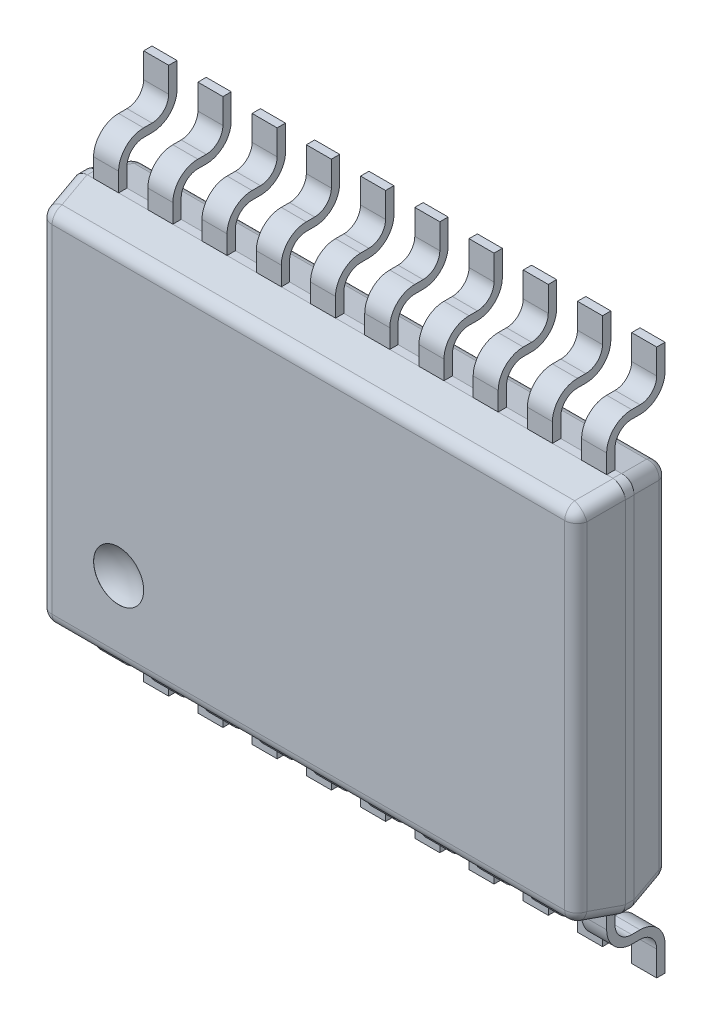
from build123d import *
from OCP.BRepFilletAPI import BRepFilletAPI_MakeChamfer

# Parameters (mm, degrees)
SKETCH1_W         = 6.6
SKETCH1_H         = 4.5
EXTRUDE2_DEPTH    = 1.1
CHAMFER2_SIZE     = 0.5
CHAMFER2_SIZE2    = 0.106278281
CHAMFER3_SIZE     = 0.5
CHAMFER3_SIZE2    = 0.106278281
FILLET1_R         = 0.15
SKETCH2_W         = 0.3
SKETCH2_H         = 1.025
EXTRUDE3_DEPTH    = 0.7
EXTRUDE3_2_DEPTH  = 0.7
EXTRUDE3_3_DEPTH  = 0.7
EXTRUDE3_4_DEPTH  = 0.7
EXTRUDE3_5_DEPTH  = 0.7
EXTRUDE3_6_DEPTH  = 0.7
EXTRUDE3_7_DEPTH  = 0.7
EXTRUDE3_8_DEPTH  = 0.7
EXTRUDE3_9_DEPTH  = 0.7
EXTRUDE3_10_DEPTH = 0.7
EXTRUDE4_DEPTH    = 8.266790989
SKETCH4_R         = 0.3
EXTRUDE5_DEPTH    = 0.001
DOME1_FACE_RADIUS = 0.3
DOME1_HEIGHT      = 0.1


with BuildPart() as part:
    # Sketch1 → Extrude2 (new body)
    with BuildSketch(Plane.XY.offset(0.1)):
        Rectangle(SKETCH1_W, SKETCH1_H)
    extrude(amount=EXTRUDE2_DEPTH)

    # Chamfer2: one chamfer whose edges measure the first distance from different faces: ONE call of the kernel's chamfer builder (chamfer() names one face for all edges)
    chamfer2_edges_1 = [part.edges().sort_by_distance(p)[0] for p in [
        (3.3, 0, 1.2),
    ]]
    chamfer2_side_1 = [part.faces().sort_by_distance(p)[0] for p in [
        (3.3, 0, 0.65),
    ]]
    chamfer2_edges_2 = [part.edges().sort_by_distance(p)[0] for p in [
        (0, 2.25, 1.2),
    ]]
    chamfer2_side_2 = [part.faces().sort_by_distance(p)[0] for p in [
        (0, 2.25, 0.65),
    ]]
    chamfer2_edges_3 = [part.edges().sort_by_distance(p)[0] for p in [
        (-3.3, 0, 1.2),
    ]]
    chamfer2_side_3 = [part.faces().sort_by_distance(p)[0] for p in [
        (-3.3, 0, 0.65),
    ]]
    chamfer2_edges_4 = [part.edges().sort_by_distance(p)[0] for p in [
        (0, -2.25, 1.2),
    ]]
    chamfer2_side_4 = [part.faces().sort_by_distance(p)[0] for p in [
        (0, -2.25, 0.65),
    ]]
    chamfer2 = BRepFilletAPI_MakeChamfer(part.part.solid().wrapped)
    for e in chamfer2_edges_1:
        chamfer2.Add(CHAMFER2_SIZE, CHAMFER2_SIZE2, e.wrapped, chamfer2_side_1[0].wrapped)  # the first distance lies on this face
    for e in chamfer2_edges_2:
        chamfer2.Add(CHAMFER2_SIZE, CHAMFER2_SIZE2, e.wrapped, chamfer2_side_2[0].wrapped)  # the first distance lies on this face
    for e in chamfer2_edges_3:
        chamfer2.Add(CHAMFER2_SIZE, CHAMFER2_SIZE2, e.wrapped, chamfer2_side_3[0].wrapped)  # the first distance lies on this face
    for e in chamfer2_edges_4:
        chamfer2.Add(CHAMFER2_SIZE, CHAMFER2_SIZE2, e.wrapped, chamfer2_side_4[0].wrapped)  # the first distance lies on this face
    add(Compound.cast(chamfer2.Shape()), mode=Mode.REPLACE)

    # Chamfer3: one chamfer whose edges measure the first distance from different faces: ONE call of the kernel's chamfer builder (chamfer() names one face for all edges)
    chamfer3_edges_1 = [part.edges().sort_by_distance(p)[0] for p in [
        (0, 2.25, 0.1),
    ]]
    chamfer3_side_1 = [part.faces().sort_by_distance(p)[0] for p in [
        (0, 2.25, 0.4),
    ]]
    chamfer3_edges_2 = [part.edges().sort_by_distance(p)[0] for p in [
        (3.3, 0, 0.1),
    ]]
    chamfer3_side_2 = [part.faces().sort_by_distance(p)[0] for p in [
        (3.3, 0, 0.4),
    ]]
    chamfer3_edges_3 = [part.edges().sort_by_distance(p)[0] for p in [
        (0, -2.25, 0.1),
    ]]
    chamfer3_side_3 = [part.faces().sort_by_distance(p)[0] for p in [
        (0, -2.25, 0.4),
    ]]
    chamfer3_edges_4 = [part.edges().sort_by_distance(p)[0] for p in [
        (-3.3, 0, 0.1),
    ]]
    chamfer3_side_4 = [part.faces().sort_by_distance(p)[0] for p in [
        (-3.3, 0, 0.4),
    ]]
    chamfer3 = BRepFilletAPI_MakeChamfer(part.part.solid().wrapped)
    for e in chamfer3_edges_1:
        chamfer3.Add(CHAMFER3_SIZE, CHAMFER3_SIZE2, e.wrapped, chamfer3_side_1[0].wrapped)  # the first distance lies on this face
    for e in chamfer3_edges_2:
        chamfer3.Add(CHAMFER3_SIZE, CHAMFER3_SIZE2, e.wrapped, chamfer3_side_2[0].wrapped)  # the first distance lies on this face
    for e in chamfer3_edges_3:
        chamfer3.Add(CHAMFER3_SIZE, CHAMFER3_SIZE2, e.wrapped, chamfer3_side_3[0].wrapped)  # the first distance lies on this face
    for e in chamfer3_edges_4:
        chamfer3.Add(CHAMFER3_SIZE, CHAMFER3_SIZE2, e.wrapped, chamfer3_side_4[0].wrapped)  # the first distance lies on this face
    add(Compound.cast(chamfer3.Shape()), mode=Mode.REPLACE)

    # Fillet1
    fillet1_edges = [part.edges().sort_by_distance(p)[0] for p in [
        (0, 2.143721719, 1.2),
        (-3.193721719, 0, 1.2),
        (0, -2.143721719, 1.2),
        (3.193721719, 0, 1.2),
        (3.3, 2.25, 0.65),
        (3.3, -2.25, 0.65),
        (-3.3, -2.25, 0.65),
        (-3.3, 2.25, 0.65),
        (-3.24686086, -2.19686086, 0.95),
        (-3.24686086, 2.19686086, 0.95),
        (3.24686086, -2.19686086, 0.95),
        (3.24686086, 2.19686086, 0.95),
        (0, 2.143721719, 0.1),
        (3.193721719, 0, 0.1),
        (0, -2.143721719, 0.1),
        (-3.193721719, 0, 0.1),
        (3.24686086, 2.19686086, 0.35),
        (3.24686086, -2.19686086, 0.35),
        (-3.24686086, 2.19686086, 0.35),
        (-3.24686086, -2.19686086, 0.35),
    ]]
    fillet(fillet1_edges, radius=FILLET1_R)


with BuildPart() as body_2:
    # Sketch2 → Extrude3 (new body)
    with BuildSketch(Plane.XY):
        with Locations((2.275, -2.7625)):
            Rectangle(SKETCH2_W, SKETCH2_H)
    extrude3 = extrude(amount=EXTRUDE3_DEPTH)


with BuildPart() as body_3:
    # Sketch2 → Extrude3 2 (new body)
    with BuildSketch(Plane.XY):
        with Locations((2.925, -2.7625)):
            Rectangle(SKETCH2_W, SKETCH2_H)
    extrude3_2 = extrude(amount=EXTRUDE3_2_DEPTH)


with BuildPart() as body_4:
    # Sketch2 → Extrude3 3 (new body)
    with BuildSketch(Plane.XY):
        with Locations((1.625, -2.7625)):
            Rectangle(SKETCH2_W, SKETCH2_H)
    extrude3_3 = extrude(amount=EXTRUDE3_3_DEPTH)


with BuildPart() as body_5:
    # Sketch2 → Extrude3 4 (new body)
    with BuildSketch(Plane.XY):
        with Locations((0.975, -2.7625)):
            Rectangle(SKETCH2_W, SKETCH2_H)
    extrude3_4 = extrude(amount=EXTRUDE3_4_DEPTH)


with BuildPart() as body_6:
    # Sketch2 → Extrude3 5 (new body)
    with BuildSketch(Plane.XY):
        with Locations((0.325, -2.7625)):
            Rectangle(SKETCH2_W, SKETCH2_H)
    extrude3_5 = extrude(amount=EXTRUDE3_5_DEPTH)


with BuildPart() as body_7:
    # Sketch2 → Extrude3 6 (new body)
    with BuildSketch(Plane.XY):
        with Locations((-0.325, -2.7625)):
            Rectangle(SKETCH2_W, SKETCH2_H)
    extrude3_6 = extrude(amount=EXTRUDE3_6_DEPTH)


with BuildPart() as body_8:
    # Sketch2 → Extrude3 7 (new body)
    with BuildSketch(Plane.XY):
        with Locations((-0.975, -2.7625)):
            Rectangle(SKETCH2_W, SKETCH2_H)
    extrude3_7 = extrude(amount=EXTRUDE3_7_DEPTH)


with BuildPart() as body_9:
    # Sketch2 → Extrude3 8 (new body)
    with BuildSketch(Plane.XY):
        with Locations((-1.625, -2.7625)):
            Rectangle(SKETCH2_W, SKETCH2_H)
    extrude3_8 = extrude(amount=EXTRUDE3_8_DEPTH)


with BuildPart() as body_10:
    # Sketch2 → Extrude3 9 (new body)
    with BuildSketch(Plane.XY):
        with Locations((-2.275, -2.7625)):
            Rectangle(SKETCH2_W, SKETCH2_H)
    extrude3_9 = extrude(amount=EXTRUDE3_9_DEPTH)


with BuildPart() as body_11:
    # Sketch2 → Extrude3 10 (new body)
    with BuildSketch(Plane.XY):
        with Locations((-2.925, -2.7625)):
            Rectangle(SKETCH2_W, SKETCH2_H)
    extrude3_10 = extrude(amount=EXTRUDE3_10_DEPTH)


with BuildPart() as extrude4_tool:
    # Sketch3 → Extrude4 (new, through all)
    with BuildSketch(Plane(origin=(3.075, 0, 0), x_dir=(0, 0, -1), z_dir=(1, 0, 0))):
        with BuildLine():
            Line((-0.1, -2.975), (-0.1, -3.275))
            Line((-0.1, -3.275), (-0.7, -3.275))
            Line((-0.7, -3.275), (-0.7, -2.475))
            ThreePointArc((-0.7, -2.475), (-0.612132034, -2.687132034), (-0.4, -2.775))
            Line((-0.4, -2.775), (-0.3, -2.775))
            ThreePointArc((-0.3, -2.775), (-0.158578644, -2.833578644), (-0.1, -2.975))
        make_face()
        with BuildLine():
            Line((-0.6, -2.25), (0, -2.25))
            Line((0, -2.25), (0, -2.975))
            ThreePointArc((0, -2.975), (-0.087867966, -2.762867966), (-0.3, -2.675))
            Line((-0.3, -2.675), (-0.4, -2.675))
            ThreePointArc((-0.4, -2.675), (-0.541421356, -2.616421356), (-0.6, -2.475))
            Line((-0.6, -2.475), (-0.6, -2.25))
        make_face()
    extrude4 = extrude(amount=-EXTRUDE4_DEPTH)


with BuildPart() as body_2_1:
    add(body_2.part)

    # Extrude4: cut by extrude4_tool
    add(extrude4_tool.part, mode=Mode.SUBTRACT)


with BuildPart() as body_3_1:
    add(body_3.part)

    # Extrude4: cut by extrude4_tool
    add(extrude4_tool.part, mode=Mode.SUBTRACT)


with BuildPart() as body_4_1:
    add(body_4.part)

    # Extrude4: cut by extrude4_tool
    add(extrude4_tool.part, mode=Mode.SUBTRACT)


with BuildPart() as body_5_1:
    add(body_5.part)

    # Extrude4: cut by extrude4_tool
    add(extrude4_tool.part, mode=Mode.SUBTRACT)


with BuildPart() as body_6_1:
    add(body_6.part)

    # Extrude4: cut by extrude4_tool
    add(extrude4_tool.part, mode=Mode.SUBTRACT)


with BuildPart() as body_7_1:
    add(body_7.part)

    # Extrude4: cut by extrude4_tool
    add(extrude4_tool.part, mode=Mode.SUBTRACT)


with BuildPart() as body_8_1:
    add(body_8.part)

    # Extrude4: cut by extrude4_tool
    add(extrude4_tool.part, mode=Mode.SUBTRACT)


with BuildPart() as body_9_1:
    add(body_9.part)

    # Extrude4: cut by extrude4_tool
    add(extrude4_tool.part, mode=Mode.SUBTRACT)


with BuildPart() as body_10_1:
    add(body_10.part)

    # Extrude4: cut by extrude4_tool
    add(extrude4_tool.part, mode=Mode.SUBTRACT)


with BuildPart() as body_11_1:
    add(body_11.part)

    # Extrude4: cut by extrude4_tool
    add(extrude4_tool.part, mode=Mode.SUBTRACT)


with BuildPart() as part_1:
    add(part.part)

    # Mirror1: Extrude3, Extrude3 2, Extrude3 3, Extrude3 4, Extrude3 5, Extrude3 6, Extrude3 7, Extrude3 8, Extrude3 9, Extrude3 10, Extrude4 across plane
    add(extrude3.mirror(Plane.ZX))
    add(extrude3_2.mirror(Plane.ZX))
    add(extrude3_3.mirror(Plane.ZX))
    add(extrude3_4.mirror(Plane.ZX))
    add(extrude3_5.mirror(Plane.ZX))
    add(extrude3_6.mirror(Plane.ZX))
    add(extrude3_7.mirror(Plane.ZX))
    add(extrude3_8.mirror(Plane.ZX))
    add(extrude3_9.mirror(Plane.ZX))
    add(extrude3_10.mirror(Plane.ZX))
    add(extrude4.mirror(Plane.ZX), mode=Mode.SUBTRACT)

    # Sketch4 → Extrude5 (cut)
    with BuildSketch(Plane.XY.offset(1.2)):
        with Locations((-2.275, -1.225)):
            Circle(SKETCH4_R)
    extrude(amount=-EXTRUDE5_DEPTH, mode=Mode.SUBTRACT)

    # Dome1: a dome of height H over a round flat face of radius A is a cap of a sphere of radius (A * A + H * H) / (2 * H)
    dome1_r = (DOME1_FACE_RADIUS * DOME1_FACE_RADIUS + DOME1_HEIGHT * DOME1_HEIGHT) / (2 * DOME1_HEIGHT)
    dome1_base = Plane((-2.275, -1.225, 1.199), z_dir=(0, 0, -1))
    with Locations(dome1_base.offset(DOME1_HEIGHT - dome1_r)):
        dome1_ball = Sphere(dome1_r, mode=Mode.PRIVATE)
    add(split(dome1_ball, bisect_by=dome1_base, keep=Keep.TOP, mode=Mode.PRIVATE), mode=Mode.SUBTRACT)


solid = Compound([body_2_1.part, body_3_1.part, body_4_1.part, body_5_1.part, body_6_1.part, body_7_1.part, body_8_1.part, body_9_1.part, body_10_1.part, body_11_1.part, part_1.part])
